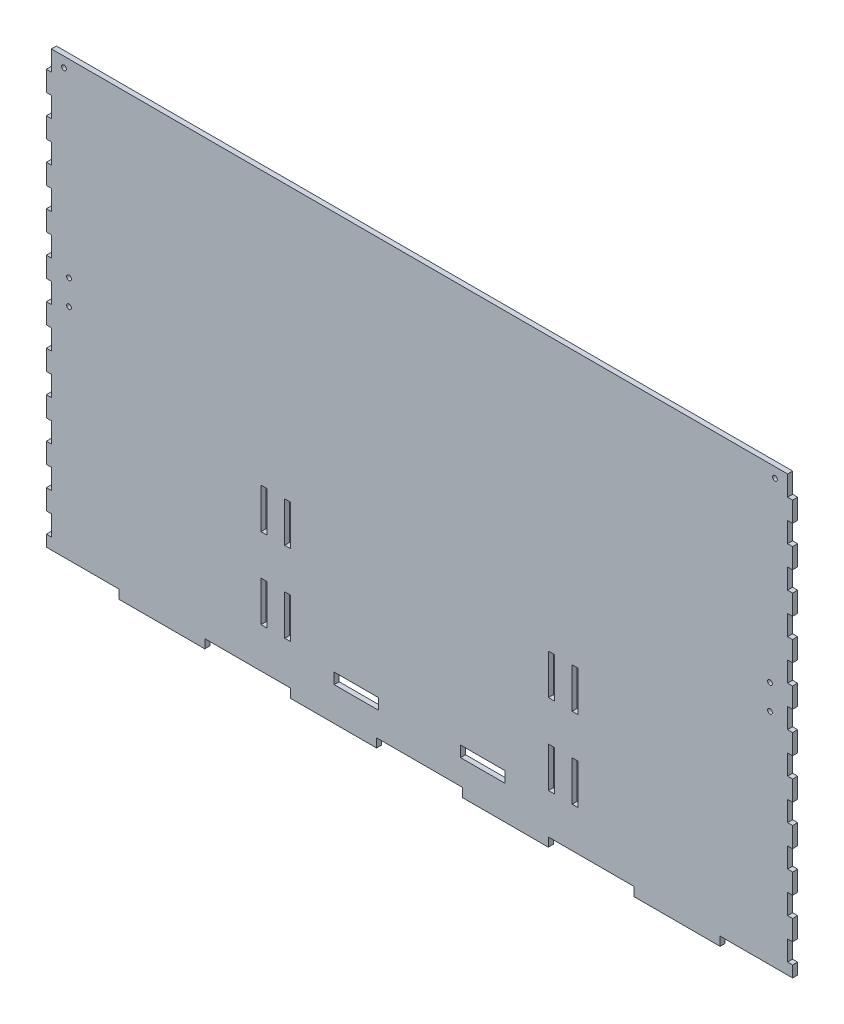
from build123d import *

# Parameters (mm, degrees)
SKETCH1_W                  = 3.175
SKETCH1_H                  = 12.7
MAIN_EXTRUDE_DEPTH         = 3.175
SKETCH8_R                  = 1.5
SKETCH8_W                  = 3.175
SKETCH8_H                  = 31.877
MOUNT_HOLES_DEPTH          = 430.752406189
SKETCH5_W                  = 3.67809758
SKETCH5_H                  = 25.4
DOOR_GUIDE_SLOTS_DEPTH     = 430.752406189
SKETCH7_W                  = 27.94
SKETCH7_H                  = 6.889027878
LEVER_HOLES_DEPTH          = 430.752406189
SKETCH12_R                 = 1.5
EXTENSION_CLIP_HOLES_DEPTH = 430.752406189
EXTENSION_CENTER_CUT_DEPTH = 430.752406189


with BuildPart() as part:
    # Sketch1 → Main Extrude (new body)
    with BuildSketch(Plane.XY):
        Polygon((-381, 139.7), (-406.4, 139.7), (-406.4, -139.7), (-352.213333333, -139.7), (-352.213333333, -134.112), (-298.026666667, -134.112), (-298.026666667, -139.7), (-243.84, -139.7), (-243.84, -134.112), (-189.653333333, -134.112), (-189.653333333, -139.7), (-135.466666667, -139.7), (-135.466666667, -134.112), (-81.28, -134.112), (-81.28, -139.7), (-27.093333333, -139.7), (-27.093333333, -134.112), (27.093333333, -134.112), (27.093333333, -139.7), (81.28, -139.7), (81.28, -134.112), (135.466666667, -134.112), (135.466666667, -139.7), (189.653333333, -139.7), (189.653333333, -134.112), (243.84, -134.112), (243.84, -139.7), (298.026666667, -139.7), (298.026666667, -134.112), (352.213333333, -134.112), (352.213333333, -139.7), (406.4, -139.7), (406.4, 139.7), (381, 139.7), (381, 127), (377.825, 127), (377.825, 139.7), (-377.825, 139.7), (-377.825, 127), (-381, 127), align=None)
        with Locations((-379.4125, 107.95)):
            Rectangle(SKETCH1_W, SKETCH1_H, mode=Mode.SUBTRACT)
        with Locations((-379.4125, 82.55)):
            Rectangle(SKETCH1_W, SKETCH1_H, mode=Mode.SUBTRACT)
        with Locations((-379.4125, 57.15)):
            Rectangle(SKETCH1_W, SKETCH1_H, mode=Mode.SUBTRACT)
        with Locations((-379.4125, 31.75)):
            Rectangle(SKETCH1_W, SKETCH1_H, mode=Mode.SUBTRACT)
        with Locations((-379.4125, 6.35)):
            Rectangle(SKETCH1_W, SKETCH1_H, mode=Mode.SUBTRACT)
        with Locations((-379.4125, -19.05)):
            Rectangle(SKETCH1_W, SKETCH1_H, mode=Mode.SUBTRACT)
        with Locations((-379.4125, -44.45)):
            Rectangle(SKETCH1_W, SKETCH1_H, mode=Mode.SUBTRACT)
        with Locations((-379.4125, -69.85)):
            Rectangle(SKETCH1_W, SKETCH1_H, mode=Mode.SUBTRACT)
        with Locations((-379.4125, -95.25)):
            Rectangle(SKETCH1_W, SKETCH1_H, mode=Mode.SUBTRACT)
        with Locations((-379.4125, -120.65)):
            Rectangle(SKETCH1_W, SKETCH1_H, mode=Mode.SUBTRACT)
        with Locations((379.4125, 107.95)):
            Rectangle(SKETCH1_W, SKETCH1_H, mode=Mode.SUBTRACT)
        with Locations((379.4125, 82.55)):
            Rectangle(SKETCH1_W, SKETCH1_H, mode=Mode.SUBTRACT)
        with Locations((379.4125, 57.15)):
            Rectangle(SKETCH1_W, SKETCH1_H, mode=Mode.SUBTRACT)
        with Locations((379.4125, 31.75)):
            Rectangle(SKETCH1_W, SKETCH1_H, mode=Mode.SUBTRACT)
        with Locations((379.4125, 6.35)):
            Rectangle(SKETCH1_W, SKETCH1_H, mode=Mode.SUBTRACT)
        with Locations((379.4125, -19.05)):
            Rectangle(SKETCH1_W, SKETCH1_H, mode=Mode.SUBTRACT)
        with Locations((379.4125, -44.45)):
            Rectangle(SKETCH1_W, SKETCH1_H, mode=Mode.SUBTRACT)
        with Locations((379.4125, -69.85)):
            Rectangle(SKETCH1_W, SKETCH1_H, mode=Mode.SUBTRACT)
        with Locations((379.4125, -95.25)):
            Rectangle(SKETCH1_W, SKETCH1_H, mode=Mode.SUBTRACT)
        with Locations((379.4125, -120.65)):
            Rectangle(SKETCH1_W, SKETCH1_H, mode=Mode.SUBTRACT)
    extrude(amount=MAIN_EXTRUDE_DEPTH)

    # Sketch8 → Mount Holes (cut, through all)
    with BuildSketch(Plane.XY.offset(3.175)):
        with Locations((-393.7, -120.65)):
            Circle(SKETCH8_R)
        with Locations((393.7, -120.65)):
            Circle(SKETCH8_R)
        with Locations((-382.5875, 12.319)):
            Rectangle(SKETCH8_W, SKETCH8_H)
        with Locations((382.5875, 12.319)):
            Rectangle(SKETCH8_W, SKETCH8_H)
    extrude(amount=-MOUNT_HOLES_DEPTH, mode=Mode.SUBTRACT)

    # Sketch5 → Door Guide Slots (cut, through all)
    with BuildSketch(Plane.XY.offset(3.175)):
        with Locations((-98.158930703, -96.012)):
            Rectangle(SKETCH5_W, SKETCH5_H)
        with Locations((-98.158930703, -45.212)):
            Rectangle(SKETCH5_W, SKETCH5_H)
        with Locations((-83.197069297, -96.012)):
            Rectangle(SKETCH5_W, SKETCH5_H)
        with Locations((-83.197069297, -45.212)):
            Rectangle(SKETCH5_W, SKETCH5_H)
        with Locations((98.158930703, -96.012)):
            Rectangle(SKETCH5_W, SKETCH5_H)
        with Locations((98.158930703, -45.212)):
            Rectangle(SKETCH5_W, SKETCH5_H)
        with Locations((83.197069297, -45.212)):
            Rectangle(SKETCH5_W, SKETCH5_H)
        with Locations((83.197069297, -96.012)):
            Rectangle(SKETCH5_W, SKETCH5_H)
    extrude(amount=-DOOR_GUIDE_SLOTS_DEPTH, mode=Mode.SUBTRACT)

    # Sketch7 → Lever Holes (cut, through all)
    with BuildSketch(Plane.XY.offset(3.175)):
        with Locations((-39.878, -115.006513954)):
            Rectangle(SKETCH7_W, SKETCH7_H)
        with Locations((39.878, -115.006513954)):
            Rectangle(SKETCH7_W, SKETCH7_H)
    extrude(amount=-LEVER_HOLES_DEPTH, mode=Mode.SUBTRACT)

    # Sketch12 → Extension Clip Holes (cut, through all)
    with BuildSketch(Plane.XY.offset(3.175)):
        with Locations((-246.507, 20.193)):
            Circle(SKETCH12_R)
        with Locations((-246.507, 4.445)):
            Circle(SKETCH12_R)
        with Locations((-221.107, 4.445)):
            Circle(SKETCH12_R)
        with Locations((-221.107, 20.193)):
            Circle(SKETCH12_R)
        with Locations((-243.332, 133.35)):
            Circle(SKETCH12_R)
        with Locations((-224.282, 133.35)):
            Circle(SKETCH12_R)
        with Locations((224.282, 133.35)):
            Circle(SKETCH12_R)
        with Locations((243.332, 133.35)):
            Circle(SKETCH12_R)
        with Locations((221.107, 20.193)):
            Circle(SKETCH12_R)
        with Locations((221.107, 4.445)):
            Circle(SKETCH12_R)
        with Locations((246.507, 4.445)):
            Circle(SKETCH12_R)
        with Locations((246.507, 20.193)):
            Circle(SKETCH12_R)
    extrude(amount=-EXTENSION_CLIP_HOLES_DEPTH, mode=Mode.SUBTRACT)

    # Sketch11<3> → Extension Center Cut (cut, through all)
    with BuildSketch(Plane.XY.offset(3.175)):
        Polygon((-232.2195, 127), (-232.2195, 139.7), (-406.4, 139.7), (-406.4, -139.7), (-235.3945, -139.7), (-235.3945, -127), (-232.2195, -127), (-232.2195, -114.3), (-235.3945, -114.3), (-235.3945, -101.6), (-232.2195, -101.6), (-232.2195, -88.9), (-235.3945, -88.9), (-235.3945, -76.2), (-232.2195, -76.2), (-232.2195, -63.5), (-235.3945, -63.5), (-235.3945, -50.8), (-232.2195, -50.8), (-232.2195, -38.1), (-235.3945, -38.1), (-235.3945, -25.4), (-232.2195, -25.4), (-232.2195, -12.7), (-235.3945, -12.7), (-235.3945, 0), (-232.2195, 0), (-232.2195, 12.7), (-235.3945, 12.7), (-235.3945, 25.4), (-232.2195, 25.4), (-232.2195, 38.1), (-235.3945, 38.1), (-235.3945, 50.8), (-232.2195, 50.8), (-232.2195, 63.5), (-235.3945, 63.5), (-235.3945, 76.2), (-232.2195, 76.2), (-232.2195, 88.9), (-235.3945, 88.9), (-235.3945, 101.6), (-232.2195, 101.6), (-232.2195, 114.3), (-235.3945, 114.3), (-235.3945, 127), align=None)
        Polygon((406.4, 139.7), (232.2195, 139.7), (232.2195, 127), (235.3945, 127), (235.3945, 114.3), (232.2195, 114.3), (232.2195, 101.6), (235.3945, 101.6), (235.3945, 88.9), (232.2195, 88.9), (232.2195, 76.2), (235.3945, 76.2), (235.3945, 63.5), (232.2195, 63.5), (232.2195, 50.8), (235.3945, 50.8), (235.3945, 38.1), (232.2195, 38.1), (232.2195, 25.4), (235.3945, 25.4), (235.3945, 12.7), (232.2195, 12.7), (232.2195, 0), (235.3945, 0), (235.3945, -12.7), (232.2195, -12.7), (232.2195, -25.4), (235.3945, -25.4), (235.3945, -38.1), (232.2195, -38.1), (232.2195, -50.8), (235.3945, -50.8), (235.3945, -63.5), (232.2195, -63.5), (232.2195, -76.2), (235.3945, -76.2), (235.3945, -88.9), (232.2195, -88.9), (232.2195, -101.6), (235.3945, -101.6), (235.3945, -114.3), (232.2195, -114.3), (232.2195, -127), (235.3945, -127), (235.3945, -139.7), (406.4, -139.7), align=None)
    extrude(amount=-EXTENSION_CENTER_CUT_DEPTH, mode=Mode.SUBTRACT)


solid = part.part
